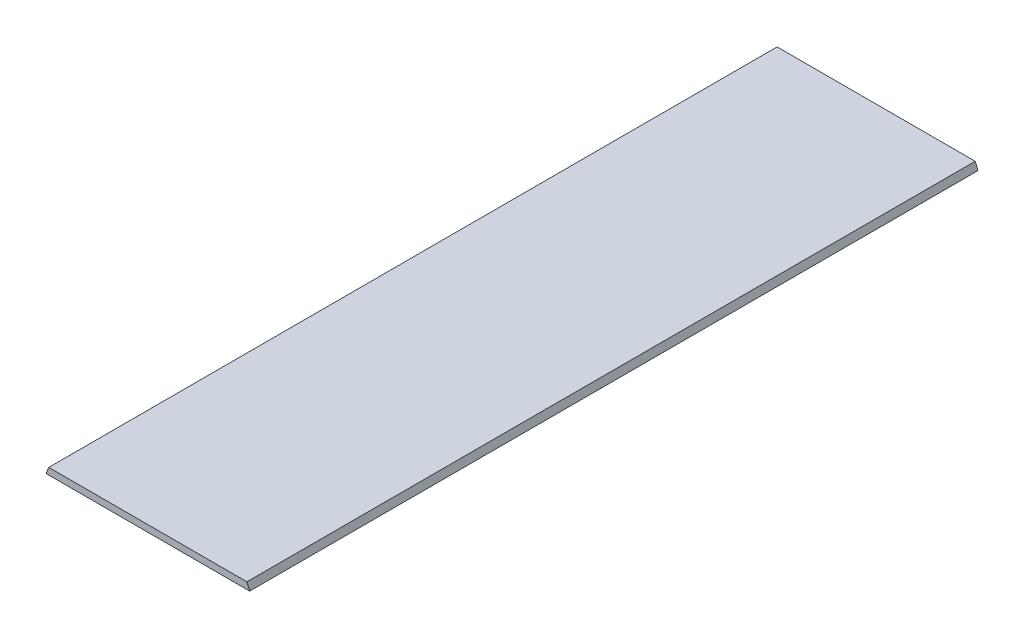
from build123d import *

# Parameters (mm, degrees)
BOSS_EXTRUDE1_DEPTH = 692.15


with BuildPart() as part:
    # Sketch1 → Boss-Extrude1 (new body)
    with BuildSketch(Plane.XY):
        Polygon((0, 0), (2.630256121, 6.35), (190.917743879, 6.35), (193.548, 0), align=None)
    extrude(amount=BOSS_EXTRUDE1_DEPTH)


solid = part.part
